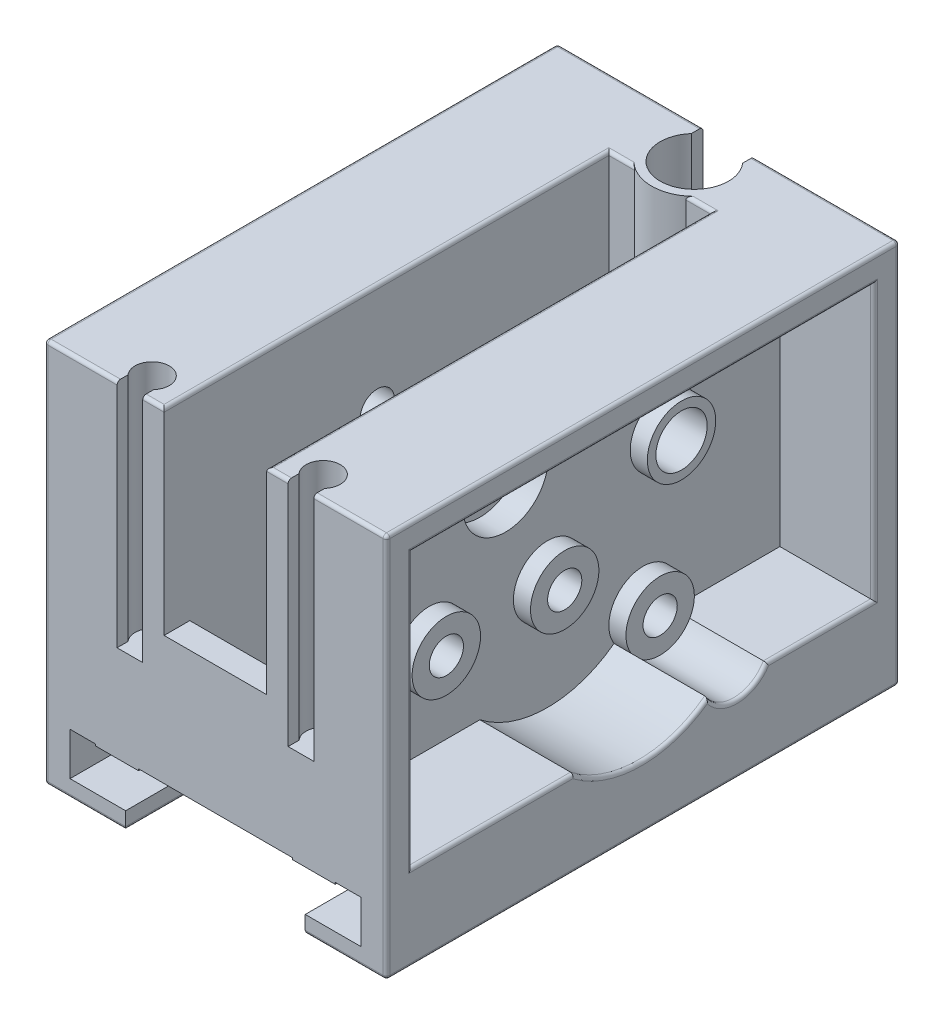
from build123d import *
from build123d.topology import SkipClean

# Parameters (mm, degrees)
SKETCH_1_W           = 20
SKETCH_1_H           = 22.5
EXTRUDE_1_DEPTH      = 30
CUT_EXTRUDE_1_DEPTH  = 39.810436741
CUT_EXTRUDE_2_DEPTH  = 18.5
CUT_EXTRUDE_3_DEPTH  = 17
SKETCH_5_W           = 6
SKETCH_5_H           = 1.5
CUT_EXTRUDE_4_DEPTH  = 11.5
CUT_EXTRUDE_5_DEPTH  = 13.5
SKETCH_7_W           = 2.5
SKETCH_7_H           = 30
EXTRUDE_2_DEPTH      = 0.1
CUT_EXTRUDE_6_REACH  = 38.637
SKETCH_8_W           = 6
SKETCH_8_H           = 9
SKETCH_9_R           = 1
SKETCH_9_R_2         = 1.5
CUT_EXTRUDE_7_DEPTH  = 43.5
CUT_EXTRUDE_9_DEPTH  = 5.5
CUT_EXTRUDE_10_REACH = 44.5
SKETCH_12_R          = 2.5
CUT_EXTRUDE_START    = -5.5
CUT_EXTRUDE_11_DEPTH = 5.5
EXTRUDE_3_DEPTH      = 12.5
EXTRUDE_START        = 0.5
EXTRUDE_4_DEPTH      = 0.5
EXTRUDE_START_2      = 1
SKETCH_16_R          = 2
SKETCH_16_R_2        = 1.5
SKETCH_16_R_3        = 1
EXTRUDE_5_DEPTH      = 1
SKETCH_17_R          = 2
SKETCH_17_R_2        = 1
SKETCH_17_R_3        = 1.5
EXTRUDE_6_DEPTH      = 1
FILLET_1_R           = 0.2
FILLET_2_R           = 0.2


with BuildPart() as part:
    # 草图1 → 凸台-拉伸1 (new body)
    with BuildSketch(Plane.XY):
        with Locations((0, 11.25)):
            Rectangle(SKETCH_1_W, SKETCH_1_H)
    extrude(amount=-EXTRUDE_1_DEPTH)

    # 草图2 → 切除-拉伸1 (cut, through all)
    with BuildSketch(Plane.XY):
        Polygon((-5.25, 0), (5.25, 0), (5.25, 1), (8.5, 1), (8.5, 3.5), (-8.5, 3.5), (-8.5, 1), (-5.25, 1), align=None)
    extrude(amount=-CUT_EXTRUDE_1_DEPTH, mode=Mode.SUBTRACT)

    # 草图3 → 切除-拉伸2 (cut)
    with BuildSketch(Plane(origin=(0, 22.5, 0), x_dir=(-1, 0, 0), z_dir=(0, 1, 0))):
        with BuildLine():
            Line((-1.5, -26), (-3, -26))
            Line((-3, -26), (-3, -1.5))
            Line((-3, -1.5), (3, -1.5))
            Line((3, -1.5), (3, -26))
            Line((3, -26), (1.5, -26))
            ThreePointArc((1.5, -26), (0, -25.5), (-1.5, -26))
        make_face()
    extrude(amount=-CUT_EXTRUDE_2_DEPTH, mode=Mode.SUBTRACT)

    # 草图4 → 切除-拉伸3 (cut)
    with BuildSketch(Plane(origin=(0, 22.5, 0), x_dir=(-1, 0, 0), z_dir=(0, 1, 0))):
        with BuildLine():
            Line((1.5, -30), (-1.5, -30))
            Line((-1.5, -30), (-1.5, -29.322875656))
            ThreePointArc((-1.5, -29.322875656), (0, -26), (1.5, -29.322875656))
            Line((1.5, -29.322875656), (1.5, -30))
        make_face()
    extrude(amount=-CUT_EXTRUDE_3_DEPTH, mode=Mode.SUBTRACT)

    # 草图5 → 切除-拉伸4 (cut)
    with BuildSketch(Plane(origin=(0, 22.5, 0), x_dir=(-1, 0, 0), z_dir=(0, 1, 0))):
        with Locations((0, -0.75)):
            Rectangle(SKETCH_5_W, SKETCH_5_H)
    extrude(amount=-CUT_EXTRUDE_4_DEPTH, mode=Mode.SUBTRACT)

    # 草图6 → 切除-拉伸5 (cut)
    with BuildSketch(Plane(origin=(0, 22.5, 0), x_dir=(-1, 0, 0), z_dir=(0, 1, 0))):
        with BuildLine():
            Line((5.75, 0), (4.25, 0))
            Line((4.25, 0), (4.25, -0.638562172))
            ThreePointArc((4.25, -0.638562172), (5, -2.3), (5.75, -0.638562172))
            Line((5.75, -0.638562172), (5.75, 0))
        make_face()
        with BuildLine():
            Line((-4.25, 0), (-5.75, 0))
            Line((-5.75, 0), (-5.75, -0.638562172))
            ThreePointArc((-5.75, -0.638562172), (-5, -2.3), (-4.25, -0.638562172))
            Line((-4.25, -0.638562172), (-4.25, 0))
        make_face()
    extrude(amount=-CUT_EXTRUDE_5_DEPTH, mode=Mode.SUBTRACT)

    # 草图7 → 凸台-拉伸2 (add)
    with BuildSketch(Plane.XZ.offset(-3.5)):
        with Locations((-5.75, -15)):
            Rectangle(SKETCH_7_W, SKETCH_7_H)
        with Locations((5.75, -15)):
            Rectangle(SKETCH_7_W, SKETCH_7_H)
    extrude(amount=EXTRUDE_2_DEPTH)

    # 草图8 → 切除-拉伸6 (cut, up to next)
    with BuildSketch(Plane(origin=(0, 4, 0), x_dir=(-1, 0, 0), z_dir=(0, 1, 0)), mode=Mode.PRIVATE) as cut_extrude_6_sk1:
        with Locations((0, -20.5)):
            Rectangle(SKETCH_8_W, SKETCH_8_H)
    cut_extrude_6_tool1 = extrude(cut_extrude_6_sk1.sketch, amount=-CUT_EXTRUDE_6_REACH, mode=Mode.PRIVATE) & part.part
    add(cut_extrude_6_tool1.solids().sort_by_distance((0, 4, -20.5))[0], mode=Mode.SUBTRACT)

    # 草图9 → 切除-拉伸7 (cut, through all)
    with BuildSketch(Plane.ZY.offset(10)):
        with Locations((-20.5, 6)):
            Circle(SKETCH_9_R)
        with Locations((-21.75, 14.25)):
            Circle(SKETCH_9_R_2)
        with Locations((-14.92, 10.09)):
            Circle(SKETCH_9_R)
        with Locations((-8, 10.22)):
            Circle(SKETCH_9_R)
        with Locations((-12.46, 16.25)):
            Circle(SKETCH_9_R)
    extrude(amount=-CUT_EXTRUDE_7_DEPTH, mode=Mode.SUBTRACT)

    # 草图11 → 切除-拉伸9 (cut)
    with BuildSketch(Plane.ZY.offset(10)):
        with BuildLine():
            Line((-18.767949192, 5), (-1.5, 5))
            Line((-1.5, 5), (-1.5, 21))
            Line((-1.5, 21), (-28.5, 21))
            Line((-28.5, 21), (-28.5, 5))
            Line((-28.5, 5), (-22.232050808, 5))
            ThreePointArc((-22.232050808, 5), (-20.5, 4), (-18.767949192, 5))
        make_face()
    extrude(amount=-CUT_EXTRUDE_9_DEPTH, mode=Mode.SUBTRACT)

    # 草图12 → 切除-拉伸10 (cut, up to next)
    with BuildSketch(Plane(origin=(10, 0, 0), x_dir=(0, 0, -1), z_dir=(1, 0, 0)), mode=Mode.PRIVATE) as cut_extrude_10_sk1:
        with Locations((12.46, 16.25)):
            Circle(SKETCH_12_R)
    cut_extrude_10_tool1 = extrude(cut_extrude_10_sk1.sketch, amount=-CUT_EXTRUDE_10_REACH, mode=Mode.PRIVATE) & part.part
    add(cut_extrude_10_tool1.solids().sort_by_distance((10, 16.25, -12.46))[0], mode=Mode.SUBTRACT)

    # 草图13 → 切除-拉伸11 (cut)
    with BuildSketch(Plane(origin=(10, 0, 0), x_dir=(0, 0, -1), z_dir=(1, 0, 0)).offset(CUT_EXTRUDE_START)):
        with BuildLine():
            Line((1.5, 5), (10.958384168, 5))
            ThreePointArc((10.958384168, 5), (14.870971111, 3.640186346), (18.803778226, 4.94036247))
            ThreePointArc((18.803778226, 4.94036247), (20.534786329, 4.000302545), (22.232050808, 5))
            Line((22.232050808, 5), (28.5, 5))
            Line((28.5, 5), (28.5, 21))
            Line((28.5, 21), (1.5, 21))
            Line((1.5, 21), (1.5, 5))
        make_face()
    extrude(amount=CUT_EXTRUDE_11_DEPTH, mode=Mode.SUBTRACT)

    # 草图14 → 凸台-拉伸3 (add)
    with SkipClean():  # the faces are left unmerged after this step: merging them gives an invalid solid
        with BuildSketch(Plane.XZ.offset(-21)):
            with BuildLine():
                Line((-5.75, -0.638562172), (-5.75, -0.3))
                ThreePointArc((-5.75, -0.3), (-5, -2.55), (-4.25, -0.3))
                Line((-4.25, -0.3), (-4.25, -0.638562172))
                ThreePointArc((-4.25, -0.638562172), (-5, -2.3), (-5.75, -0.638562172))
            make_face()
            with BuildLine():
                Line((4.25, -0.3), (4.25, -0.638562172))
                ThreePointArc((4.25, -0.638562172), (5, -2.3), (5.75, -0.638562172))
                Line((5.75, -0.638562172), (5.75, -0.3))
                ThreePointArc((5.75, -0.3), (5, -2.55), (4.25, -0.3))
            make_face()
        extrude(amount=EXTRUDE_3_DEPTH)

    # 草图15 → 凸台-拉伸4 (add)
    with SkipClean():  # the faces are left unmerged after this step: merging them gives an invalid solid
        with BuildSketch(Plane(origin=(0, 8.5, 0), x_dir=(-1, 0, 0), z_dir=(0, 1, 0)).offset(EXTRUDE_START)):
            with BuildLine():
                Line((-4.5, -1.5), (-4.5, -2.166025404))
                ThreePointArc((-4.5, -2.166025404), (-5.410424762, -2.211894465), (-5.979795897, -1.5))
                Line((-5.979795897, -1.5), (-4.5, -1.5))
            make_face()
            with BuildLine():
                Line((4.5, -1.5), (5.979795897, -1.5))
                ThreePointArc((5.979795897, -1.5), (5.410424762, -2.211894465), (4.5, -2.166025404))
                Line((4.5, -2.166025404), (4.5, -1.5))
            make_face()
        extrude(amount=-EXTRUDE_4_DEPTH)

    # 草图16 → 凸台-拉伸5 (add)
    # profile 1 of 5: a face of its own
    with BuildSketch(Plane.ZY.offset(4.5).offset(EXTRUDE_START_2)):
        with Locations((-21.75, 14.25)):
            Circle(SKETCH_16_R)
        with Locations(Location((-21.75, 14.25, 0), (0, 0, 180))):
            Circle(SKETCH_16_R_2, mode=Mode.SUBTRACT)
    # profile 2 of 5: a face of its own
    with BuildSketch(Plane.ZY.offset(4.5).offset(EXTRUDE_START_2)):
        with Locations((-14.92, 10.09)):
            Circle(SKETCH_16_R)
        with Locations(Location((-14.92, 10.09, 0), (0, 0, 180))):
            Circle(SKETCH_16_R_3, mode=Mode.SUBTRACT)
    # profile 3 of 5: a face of its own
    with BuildSketch(Plane.ZY.offset(4.5).offset(EXTRUDE_START_2)):
        with Locations((-12.46, 16.25)):
            Circle(SKETCH_16_R)
        with Locations((-12.46, 16.25)):
            Circle(SKETCH_16_R_3, mode=Mode.SUBTRACT)
    # profile 4 of 5: a face of its own
    with BuildSketch(Plane.ZY.offset(4.5).offset(EXTRUDE_START_2)):
        with Locations((-8, 10.22)):
            Circle(SKETCH_16_R)
        with Locations(Location((-8, 10.22, 0), (0, 0, 180))):
            Circle(SKETCH_16_R_3, mode=Mode.SUBTRACT)
    # profile 5 of 5: a face of its own
    with BuildSketch(Plane.ZY.offset(4.5).offset(EXTRUDE_START_2)):
        with Locations((-20.5, 6)):
            Circle(SKETCH_16_R)
        with Locations(Location((-20.5, 6, 0), (0, 0, 180))):
            Circle(SKETCH_16_R_3, mode=Mode.SUBTRACT)
    extrude(amount=-EXTRUDE_5_DEPTH)

    # 草图17 → 凸台-拉伸6 (add)
    # profile 1 of 4: a face of its own
    with SkipClean():  # the faces are left unmerged after this step: merging them gives an invalid solid
        with BuildSketch(Plane(origin=(4.5, 0, 0), x_dir=(0, 0, -1), z_dir=(1, 0, 0))):
            with Locations(Location((8, 10.22, 0), (0, 0, 180))):
                Circle(SKETCH_17_R)
            with Locations((8, 10.22)):
                Circle(SKETCH_17_R_2, mode=Mode.SUBTRACT)
        # profile 2 of 4: a face of its own
        with BuildSketch(Plane(origin=(4.5, 0, 0), x_dir=(0, 0, -1), z_dir=(1, 0, 0))):
            with Locations(Location((14.92, 10.09, 0), (0, 0, 180))):
                Circle(SKETCH_17_R)
            with Locations((14.92, 10.09)):
                Circle(SKETCH_17_R_2, mode=Mode.SUBTRACT)
        # profile 3 of 4: a face of its own
        with BuildSketch(Plane(origin=(4.5, 0, 0), x_dir=(0, 0, -1), z_dir=(1, 0, 0))):
            with Locations(Location((21.75, 14.25, 0), (0, 0, 180))):
                Circle(SKETCH_17_R)
            with Locations((21.75, 14.25)):
                Circle(SKETCH_17_R_3, mode=Mode.SUBTRACT)
        # profile 4 of 4: a face of its own
        with BuildSketch(Plane(origin=(4.5, 0, 0), x_dir=(0, 0, -1), z_dir=(1, 0, 0))):
            with Locations((20.5, 6)):
                Circle(SKETCH_17_R)
            with Locations((20.5, 6)):
                Circle(SKETCH_17_R_2, mode=Mode.SUBTRACT)
        extrude(amount=EXTRUDE_6_DEPTH)
    add(part.part.scale(1), mode=Mode.REPLACE)  # the faces are merged on a copy

    # 圆角1
    fillet_1_edges = [part.edges().sort_by_distance(p)[0] for p in [
        (10, 11.25, -30),
        (7.625, 0, 0),
        (7.625, 0, -30),
        (-10, 13, -1.5),
        (-10, 21, -15),
        (-10, 13, -28.5),
        (-10, 5, -25.366025404),
        (-10, 4, -20.5),
        (-10, 5, -10.133974596),
        (-5.25, 0, -15),
        (5.25, 0, -15),
        (10, 13, -1.5),
        (10, 5, -6.229192084),
        (10, 3.640186346, -14.870971111),
        (10, 4.000302545, -20.534786329),
        (10, 5, -25.366025404),
        (10, 13, -28.5),
        (10, 21, -15),
        (-10, 11.25, -30),
        (10, 11.25, 0),
        (-7.625, 0, 0),
        (-10, 11.25, 0),
        (-7.625, 0, -30),
        (-10, 22.5, -15),
        (10, 22.5, -15),
        (10, 0, -15),
        (-10, 0, -15),
    ]]
    fillet(fillet_1_edges, radius=FILLET_1_R)

    # 圆角2
    # the kernel refuses this fillet: 0.2 mm, written as the material it takes off along each edge
    with BuildSketch(Plane(origin=(9.8, 22.3, -29.8), x_dir=(0, 1, 0), z_dir=(0, 0, -1))) as fillet_2_piece_1_section:
        Polygon((0, 0), (FILLET_2_R, 0), (FILLET_2_R, FILLET_2_R), (0, FILLET_2_R), align=None)
    fillet_2_piece_1 = extrude(amount=FILLET_2_R, mode=Mode.PRIVATE)
    fillet_2_piece_1 = fillet_2_piece_1 - Plane(origin=(9.8, 22.3, -29.8), x_dir=(-0.7071067811865475, -0.7071067811865475, 0), z_dir=(0, 0, -1)) * Sphere(FILLET_2_R, mode=Mode.PRIVATE)
    add(fillet_2_piece_1, mode=Mode.SUBTRACT)
    with BuildSketch(Plane(origin=(9.8, 22.3, -0.2), x_dir=(0, 1, 0), z_dir=(0, 0, 1))) as fillet_2_piece_2_section:
        Polygon((0, 0), (FILLET_2_R, 0), (FILLET_2_R, -FILLET_2_R), (0, -FILLET_2_R), align=None)
    fillet_2_piece_2 = extrude(amount=FILLET_2_R, mode=Mode.PRIVATE)
    fillet_2_piece_2 = fillet_2_piece_2 - Plane(origin=(9.8, 22.3, -0.2), x_dir=(-0.7071067811865475, -0.7071067811865475, 0), z_dir=(0, 0, 1)) * Sphere(FILLET_2_R, mode=Mode.PRIVATE)
    add(fillet_2_piece_2, mode=Mode.SUBTRACT)
    with BuildSketch(Plane(origin=(-9.8, 22.3, -0.2), x_dir=(0, 1, 0), z_dir=(0, 0, 1))) as fillet_2_piece_3_section:
        Polygon((0, 0), (FILLET_2_R, 0), (FILLET_2_R, FILLET_2_R), (0, FILLET_2_R), align=None)
    fillet_2_piece_3 = extrude(amount=FILLET_2_R, mode=Mode.PRIVATE)
    fillet_2_piece_3 = fillet_2_piece_3 - Plane(origin=(-9.8, 22.3, -0.2), x_dir=(0.7071067811865475, -0.7071067811865475, 0), z_dir=(0, 0, 1)) * Sphere(FILLET_2_R, mode=Mode.PRIVATE)
    add(fillet_2_piece_3, mode=Mode.SUBTRACT)
    with BuildSketch(Plane(origin=(-9.8, 22.3, -29.8), x_dir=(0, 1, 0), z_dir=(0, 0, -1))) as fillet_2_piece_4_section:
        Polygon((0, 0), (FILLET_2_R, 0), (FILLET_2_R, -FILLET_2_R), (0, -FILLET_2_R), align=None)
    fillet_2_piece_4 = extrude(amount=FILLET_2_R, mode=Mode.PRIVATE)
    fillet_2_piece_4 = fillet_2_piece_4 - Plane(origin=(-9.8, 22.3, -29.8), x_dir=(0.7071067811865475, -0.7071067811865475, 0), z_dir=(0, 0, -1)) * Sphere(FILLET_2_R, mode=Mode.PRIVATE)
    add(fillet_2_piece_4, mode=Mode.SUBTRACT)
    with BuildSketch(Plane(origin=(-5.25, 22.5, 0), x_dir=(0, -1, 0), z_dir=(-1, 0, 0)), Plane(origin=(9.8, 22.5, 0), x_dir=(0, -1, 0), z_dir=(-1, 0, 0))) as fillet_2_piece_5:
        with BuildLine():
            CenterArc((FILLET_2_R, -FILLET_2_R), FILLET_2_R, 90, 90)
            Line((0, -FILLET_2_R), (0, 0))
            Line((0, 0), (FILLET_2_R, 0))
        make_face()
    extrude(amount=4.55, mode=Mode.SUBTRACT)
    with BuildSketch(Plane(origin=(9.8, 22.5, -30), x_dir=(0, -1, 0), z_dir=(-1, 0, 0)), Plane(origin=(-1, 22.5, -30), x_dir=(0, -1, 0), z_dir=(-1, 0, 0))) as fillet_2_piece_6:
        with BuildLine():
            CenterArc((FILLET_2_R, FILLET_2_R), FILLET_2_R, 180, 90)
            Line((0, FILLET_2_R), (0, 0))
            Line((0, 0), (FILLET_2_R, 0))
        make_face()
    extrude(amount=8.8, mode=Mode.SUBTRACT)
    with BuildSketch(Plane(origin=(-3, 22.5, 0.5), x_dir=(-1, 0, 0), z_dir=(0, 0, -1)), Plane(origin=(3, 22.5, -26), x_dir=(1, 0, 0), z_dir=(0, 0, 1))) as fillet_2_piece_7:
        with BuildLine():
            CenterArc((FILLET_2_R, -FILLET_2_R), FILLET_2_R, 90, 90)
            Line((0, -FILLET_2_R), (0, 0))
            Line((0, 0), (FILLET_2_R, 0))
        make_face()
    extrude(amount=26.5, mode=Mode.SUBTRACT)
    with BuildSketch(Plane(origin=(1, 22.5, -26), x_dir=(0, 0, -1), z_dir=(1, 0, 0))) as fillet_2_piece_8_section:
        with BuildLine():
            CenterArc((FILLET_2_R, -FILLET_2_R), FILLET_2_R, 90, 90)
            Line((0, -FILLET_2_R), (0, 0))
            Line((0, 0), (FILLET_2_R, 0))
        make_face()
    fillet_2_piece_8 = extrude(amount=2, mode=Mode.PRIVATE)
    fillet_2_piece_8 = fillet_2_piece_8 - Plane(origin=(0, 22.453781009, -28), x_dir=(-0.6000000000000008, 0, 0.7999999999999994), z_dir=(0, 1, 0)) * Cylinder(2.5, 5, mode=Mode.PRIVATE)
    add(fillet_2_piece_8, mode=Mode.SUBTRACT)
    with BuildSketch(Plane(origin=(-3, 22.5, -26), x_dir=(0, 0, -1), z_dir=(1, 0, 0))) as fillet_2_piece_9_section:
        with BuildLine():
            CenterArc((FILLET_2_R, -FILLET_2_R), FILLET_2_R, 90, 90)
            Line((0, -FILLET_2_R), (0, 0))
            Line((0, 0), (FILLET_2_R, 0))
        make_face()
    fillet_2_piece_9 = extrude(amount=2, mode=Mode.PRIVATE)
    fillet_2_piece_9 = fillet_2_piece_9 - Plane(origin=(0, 22.453781022, -28), x_dir=(-0.6000000000000008, 0, 0.7999999999999994), z_dir=(0, 1, 0)) * Cylinder(2.5, 5, mode=Mode.PRIVATE)
    add(fillet_2_piece_9, mode=Mode.SUBTRACT)
    with BuildSketch(Plane(origin=(-2.5, 22.5, 0), x_dir=(0, -1, 0), z_dir=(-1, 0, 0)), Plane(origin=(4.75, 22.5, 0), x_dir=(0, -1, 0), z_dir=(-1, 0, 0))) as fillet_2_piece_10:
        with BuildLine():
            CenterArc((FILLET_2_R, -FILLET_2_R), FILLET_2_R, 90, 90)
            Line((0, -FILLET_2_R), (0, 0))
            Line((0, 0), (FILLET_2_R, 0))
        make_face()
    extrude(amount=2.25, mode=Mode.SUBTRACT)
    with BuildSketch(Plane(origin=(-3.5, 22.5, -26), x_dir=(0, 0, -1), z_dir=(1, 0, 0))) as fillet_2_piece_11a_section:
        with BuildLine():
            CenterArc((FILLET_2_R, -FILLET_2_R), FILLET_2_R, 90, 90)
            Line((0, -FILLET_2_R), (0, 0))
            Line((0, 0), (FILLET_2_R, 0))
        make_face()
    fillet_2_piece_11a = extrude(amount=2.5, mode=Mode.PRIVATE)
    fillet_2_piece_11a = split(fillet_2_piece_11a, bisect_by=Plane(origin=(-3, 22.454720977, -26.045279023), z_dir=(-1, 0, 0)), keep=Keep.TOP, mode=Mode.PRIVATE)
    with BuildSketch(Plane(origin=(-3, 22.5, 0.5), x_dir=(-1, 0, 0), z_dir=(0, 0, -1))) as fillet_2_piece_11b_section:
        with BuildLine():
            CenterArc((FILLET_2_R, -FILLET_2_R), FILLET_2_R, 90, 90)
            Line((0, -FILLET_2_R), (0, 0))
            Line((0, 0), (FILLET_2_R, 0))
        make_face()
    fillet_2_piece_11b = extrude(amount=27, mode=Mode.PRIVATE)
    fillet_2_piece_11b = split(fillet_2_piece_11b, bisect_by=Plane(origin=(-3.045279023, 22.454720977, -26), z_dir=(0, 0, -1)), keep=Keep.TOP, mode=Mode.PRIVATE)
    fillet_2_piece_11 = fillet_2_piece_11a & fillet_2_piece_11b
    add(fillet_2_piece_11, mode=Mode.SUBTRACT)
    with BuildSketch(Plane(origin=(3, 22.5, -26.5), x_dir=(1, 0, 0), z_dir=(0, 0, 1))) as fillet_2_piece_12a_section:
        with BuildLine():
            CenterArc((FILLET_2_R, -FILLET_2_R), FILLET_2_R, 90, 90)
            Line((0, -FILLET_2_R), (0, 0))
            Line((0, 0), (FILLET_2_R, 0))
        make_face()
    fillet_2_piece_12a = extrude(amount=27, mode=Mode.PRIVATE)
    fillet_2_piece_12a = split(fillet_2_piece_12a, bisect_by=Plane(origin=(3.045279023, 22.454720977, -26), z_dir=(0, 0, -1)), keep=Keep.TOP, mode=Mode.PRIVATE)
    with BuildSketch(Plane(origin=(1, 22.5, -26), x_dir=(0, 0, -1), z_dir=(1, 0, 0))) as fillet_2_piece_12b_section:
        with BuildLine():
            CenterArc((FILLET_2_R, -FILLET_2_R), FILLET_2_R, 90, 90)
            Line((0, -FILLET_2_R), (0, 0))
            Line((0, 0), (FILLET_2_R, 0))
        make_face()
    fillet_2_piece_12b = extrude(amount=2.5, mode=Mode.PRIVATE)
    fillet_2_piece_12b = split(fillet_2_piece_12b, bisect_by=Plane(origin=(3, 22.454720977, -26.045279023), z_dir=(1, 0, 0)), keep=Keep.TOP, mode=Mode.PRIVATE)
    fillet_2_piece_12 = fillet_2_piece_12a & fillet_2_piece_12b
    add(fillet_2_piece_12, mode=Mode.SUBTRACT)


solid = part.part
